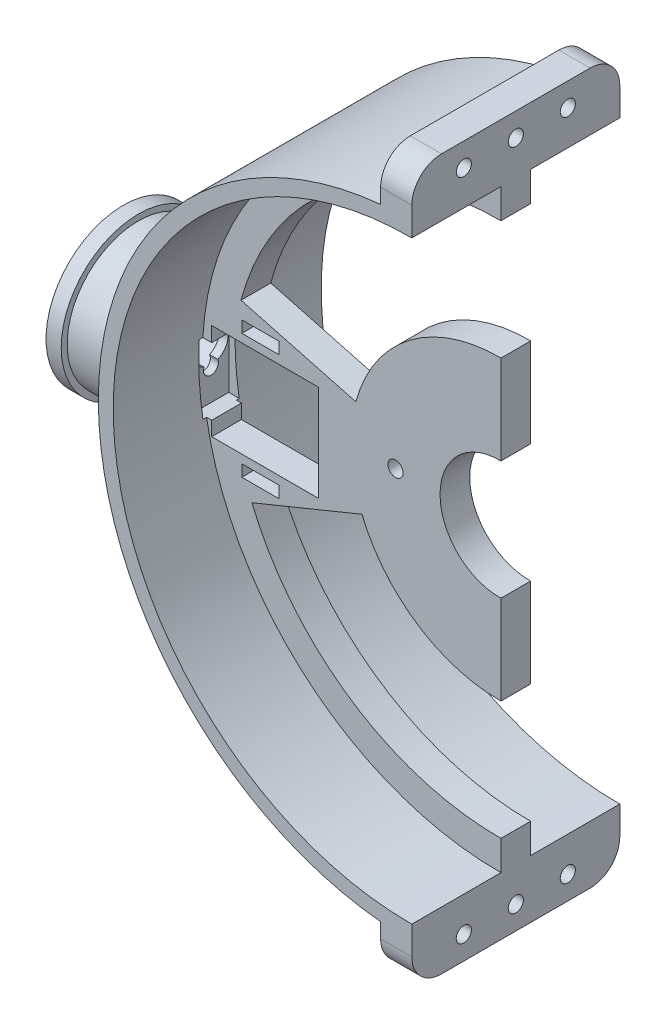
from build123d import *

# Parameters (mm, degrees)
SKETCH_1_W                = 105
SKETCH_1_H                = 10
EXTRUDE_3_DEPTH           = 10
EXTRUDE_3_DEPTH_BACK      = 20
SKETCH_11_R               = 105
SKETCH_11_R_2             = 100
EXTRUDE_START             = 20
SKETCH_12_R               = 105
SKETCH_12_R_2             = 100
EXTRUDE_4_DEPTH           = 20
SKETCH_4_R                = 25.5
SKETCH_4_R_2              = 20.5
EXTRUDE_6_DEPTH           = 20
EXTRUDE_START_2           = -31.598350223
EXTRUDE_7_OUTLINE_R       = 26
EXTRUDE_7_OUTLINE_R_2     = 21
EXTRUDE_7_DEPTH           = 30.598350223
SKETCH_6_R                = 20
CUT_EXTRUDE_1_DEPTH       = 174.040821302
CUT_EXTRUDE_8_DEPTH       = 10
CUT_EXTRUDE_START         = -4.05
SKETCH_17_W               = 12.2
SKETCH_17_H               = 22.6
CUT_EXTRUDE_9_DEPTH       = 6.15
CUT_EXTRUDE_START_2       = -35
CUT_EXTRUDE_10_DEPTH      = 35.9
SKETCH_21_W               = 12.48598734
SKETCH_21_H               = 3.935393954
CUT_EXTRUDE_11_DEPTH      = 174.040821302
SKETCH_23_W               = 21.5
SKETCH_23_H               = 4
MIRROR_START              = -126.5
MIRROR_3_OUTLINE_R        = 26
MIRROR_3_OUTLINE_R_2      = 24
MIRROR_3_DEPTH            = 21.5
SKETCH_24_R               = 20
CUT_EXTRUDE_12_DEPTH      = 174.040821302
SKETCH_25_W               = 5.25
SKETCH_25_H               = 10
CUT_EXTRUDE_13_DEPTH      = 1
EXTRUDE_8_DEPTH           = 35
FILLET_1_R                = 10
FILLET_1_OF_MIRROR_4_R    = 10
M5X0_8_1_D                = 4.2
SKETCH_38_R               = 2.55
CUT_EXTRUDE_17_DEPTH      = 190.567335177
M5X0_8_2_D                = 4.2
CUT_EXTRUDE_18_DEPTH      = 183.219119633
CUT_EXTRUDE_18_DEPTH_BACK = 183.219119633
SKETCH_39_R               = 2.55
CUT_EXTRUDE_14_DEPTH      = 183.219119633
CUT_EXTRUDE_14_DEPTH_BACK = 183.219119633
SKETCH_34_W               = 208.658629851
SKETCH_34_H               = 276.195432186


with BuildPart() as part:
    # 草图1 → 旋转1 (revolve)
    with BuildSketch(Plane(origin=(0, 0, 0), x_dir=(1, 0, 0), z_dir=(0, 1, 0))):
        with Locations((52.5, 5)):
            Rectangle(SKETCH_1_W, SKETCH_1_H)
    revolve(axis=Axis((0, 0, 0), (0, 0, -1)))

    # 草图11 → 凸台-拉伸3 (add, two sides: drawn at the far end of the back side and taken through both)
    with BuildSketch(Plane.XY.offset(-EXTRUDE_3_DEPTH_BACK)):
        Circle(SKETCH_11_R)
        Circle(SKETCH_11_R_2, mode=Mode.SUBTRACT)
    extrude(amount=EXTRUDE_3_DEPTH + EXTRUDE_3_DEPTH_BACK)

    # 草图12 → 凸台-拉伸4 (add)
    with BuildSketch(Plane.XY.offset(10).offset(EXTRUDE_START)):
        Circle(SKETCH_12_R)
        Circle(SKETCH_12_R_2, mode=Mode.SUBTRACT)
    extrude_4 = extrude(amount=-EXTRUDE_4_DEPTH)

    # 镜向1: 凸台-拉伸4 across plane
    add(extrude_4.mirror(Plane.XY.offset(-5)))

    # 草图4 → 凸台-拉伸6 (add)
    with BuildSketch(Plane(origin=(100, 0, 0), x_dir=(0, 0, -1), z_dir=(1, 0, 0))):
        with Locations((5, 0)):
            Circle(SKETCH_4_R)
        with Locations((5, 0)):
            Circle(SKETCH_4_R_2, mode=Mode.SUBTRACT)
    extrude(amount=EXTRUDE_6_DEPTH)

    # 凸台-拉伸7: read off the stored shape, not the designer's step
    # 凸台-拉伸7 outline → 凸台-拉伸7 (add)
    with BuildSketch(Plane(origin=(-100, 0, 0), x_dir=(0, 0, -1), z_dir=(1, 0, 0)).offset(EXTRUDE_START_2)):
        with Locations((5, 0)):
            Circle(EXTRUDE_7_OUTLINE_R)
        with Locations((5, 0)):
            Circle(EXTRUDE_7_OUTLINE_R_2, mode=Mode.SUBTRACT)
    extrude(amount=EXTRUDE_7_DEPTH)

    # 草图6 → 切除-拉伸1 (cut, through all)
    with BuildSketch(Plane.XY):
        with Locations((0, -70)):
            Circle(SKETCH_6_R)
        with Locations(Location((0, 70, 0), (0, 0, 180))):
            Circle(SKETCH_6_R)
    extrude(amount=-CUT_EXTRUDE_1_DEPTH, mode=Mode.SUBTRACT)

    # 草图16 → 切除-拉伸8 (cut)
    with BuildSketch(Plane(origin=(105, 0, 0), x_dir=(0, 0, -1), z_dir=(1, 0, 0))):
        with BuildLine():
            ThreePointArc((7.301532566, -5.323809524), (5, 5.8), (2.698467434, -5.323809524))
            ThreePointArc((2.698467434, -5.323809524), (5, -8.8), (7.301532566, -5.323809524))
        make_face()
    cut_extrude_8 = extrude(amount=-CUT_EXTRUDE_8_DEPTH, mode=Mode.SUBTRACT)

    # 草图17 → 切除-拉伸9 (cut)
    with BuildSketch(Plane(origin=(100, 0, 0), x_dir=(0, 0, -1), z_dir=(1, 0, 0)).offset(CUT_EXTRUDE_START)):
        with Locations((4.890474786, -5.5)):
            Rectangle(SKETCH_17_W, SKETCH_17_H)
    cut_extrude_9 = extrude(amount=CUT_EXTRUDE_9_DEPTH, mode=Mode.SUBTRACT)

    # 草图19 → 切除-拉伸10 (cut)
    with BuildSketch(Plane(origin=(95.95, 0, 0), x_dir=(0, 0, -1), z_dir=(1, 0, 0)).offset(CUT_EXTRUDE_START_2)):
        Polygon((-1.122566441, -16.8), (-1.122566441, 5.8), (-1.122566441, 10.8), (11.077433559, 10.8), (11.077433559, 5.8), (11.077433559, -16.8), (11.077433559, -21.6), (-1.122566441, -21.6), align=None)
    cut_extrude_10 = extrude(amount=CUT_EXTRUDE_10_DEPTH, mode=Mode.SUBTRACT)

    # 镜向2: 切除-拉伸8, 切除-拉伸9, 切除-拉伸10 across plane
    add(cut_extrude_8.mirror(Plane(origin=(0, 0, 0), x_dir=(0, 0, 1), z_dir=(1, 0, 0))), mode=Mode.SUBTRACT)
    add(cut_extrude_9.mirror(Plane(origin=(0, 0, 0), x_dir=(0, 0, 1), z_dir=(1, 0, 0))), mode=Mode.SUBTRACT)
    add(cut_extrude_10.mirror(Plane(origin=(0, 0, 0), x_dir=(0, 0, 1), z_dir=(1, 0, 0))), mode=Mode.SUBTRACT)

    # 草图21 → 切除-拉伸11 (cut, through all)
    with BuildSketch(Plane.XY):
        with Locations((-80.471231892, 15.58208287)):
            Rectangle(SKETCH_21_W, SKETCH_21_H)
        with Locations((-80.471231892, -26.38208287)):
            Rectangle(SKETCH_21_W, SKETCH_21_H)
        with Locations((80.471231892, -26.38208287)):
            Rectangle(SKETCH_21_W, SKETCH_21_H)
        with Locations((80.471231892, 15.58208287)):
            Rectangle(SKETCH_21_W, SKETCH_21_H)
    extrude(amount=-CUT_EXTRUDE_11_DEPTH, mode=Mode.SUBTRACT)

    # 草图23 → 切除-旋转1 (revolve, cut)
    with BuildSketch(Plane.XY.offset(-5), mode=Mode.PRIVATE) as cut_revolve_1_sk:
        with Locations((115.75, 26)):
            Rectangle(SKETCH_23_W, SKETCH_23_H)
    revolve(cut_revolve_1_sk.sketch.rotate(Axis((120, 0, -5), (-1, 0, 0)), 90), axis=Axis((120, 0, -5), (-1, 0, 0)), mode=Mode.SUBTRACT)

    # 镜向3: read off the stored shape, not the designer's step
    # 镜向3 outline → 镜向3 (cut)
    with BuildSketch(Plane.YZ.offset(MIRROR_START)):
        with Locations((0, -5)):
            Circle(MIRROR_3_OUTLINE_R)
        with Locations((0, -5)):
            Circle(MIRROR_3_OUTLINE_R_2, mode=Mode.SUBTRACT)
    extrude(amount=MIRROR_3_DEPTH, mode=Mode.SUBTRACT)

    # 草图24 → 切除-拉伸12 (cut, through all)
    with BuildSketch(Plane.XY):
        Circle(SKETCH_24_R)
        with BuildLine():
            Line((-86.979425588, 23.120975852), (-48.321903105, 12.844986584))
            ThreePointArc((-48.321903105, 12.844986584), (0, 50), (48.321903105, 12.844986584))
            Line((48.321903105, 12.844986584), (86.979425588, 23.120975852))
            ThreePointArc((86.979425588, 23.120975852), (0, 90), (-86.979425588, 23.120975852))
        make_face()
        with BuildLine():
            Line((46.279615655, -18.926097718), (83.303308179, -34.066975893))
            ThreePointArc((83.303308179, -34.066975893), (0, -90), (-83.303308179, -34.066975893))
            Line((-83.303308179, -34.066975893), (-46.279615655, -18.926097718))
            ThreePointArc((-46.279615655, -18.926097718), (0, -50), (46.279615655, -18.926097718))
        make_face()
    extrude(amount=-CUT_EXTRUDE_12_DEPTH, mode=Mode.SUBTRACT)

    # 草图25 → 切除-拉伸13 (cut)
    with BuildSketch(Plane.XZ.offset(-5.8)):
        with Locations((99.475, -5)):
            Rectangle(SKETCH_25_W, SKETCH_25_H)
    extrude(amount=-CUT_EXTRUDE_13_DEPTH, mode=Mode.SUBTRACT)

    # 草图26 → 凸台-拉伸8 (add, symmetric)
    with BuildSketch(Plane.XY.offset(-5)):
        with BuildLine():
            Line((-10, 104.522724802), (-10, 119.522724802))
            Line((-10, 119.522724802), (10, 119.522724802))
            Line((10, 119.522724802), (10, 104.522724802))
            ThreePointArc((10, 104.522724802), (0, 105), (-10, 104.522724802))
        make_face()
    extrude_8 = extrude(amount=EXTRUDE_8_DEPTH, both=True)

    # 圆角1
    fillet_1_edges = [part.edges().sort_by_distance(p)[0] for p in [
        (0, 119.522724802, -40),
        (0, 119.522724802, 30),
    ]]
    fillet(fillet_1_edges, radius=FILLET_1_R)

    # 镜向4: 凸台-拉伸8 across plane
    add(extrude_8.mirror(Plane.ZX))

    # 圆角1 of 镜向4
    fillet_1_of_mirror_4_edges = [part.edges().sort_by_distance(p)[0] for p in [
        (0, -119.522724802, -40),
        (0, -119.522724802, 30),
    ]]
    fillet(fillet_1_of_mirror_4_edges, radius=FILLET_1_OF_MIRROR_4_R)

    # M5x0.8 螺纹孔1 (through all)
    with Locations(Plane(origin=(10, 0, 0), x_dir=(0, 0, -1), z_dir=(1, 0, 0))):
        with Locations((-12.5, 111.675356556), (5, 111.675356556), (22.5, 111.675356556)):
            m5x0_8_1 = Hole(M5X0_8_1_D / 2)

    # 草图38 → 切除-拉伸17 (cut, through all)
    with BuildSketch(Plane(origin=(10, 0, 0), x_dir=(0, 0, -1), z_dir=(1, 0, 0))):
        with Locations((-12.5, 111.675356556)):
            Circle(SKETCH_38_R)
        with Locations((5, 111.675356556)):
            Circle(SKETCH_38_R)
        with Locations((22.5, 111.675356556)):
            Circle(SKETCH_38_R)
    cut_extrude_17 = extrude(amount=-CUT_EXTRUDE_17_DEPTH, mode=Mode.SUBTRACT)

    # 镜向5: M5x0.8 螺纹孔1, 切除-拉伸17 across plane
    add(m5x0_8_1.mirror(Plane.ZX), mode=Mode.SUBTRACT)
    add(cut_extrude_17.mirror(Plane.ZX), mode=Mode.SUBTRACT)

    # M5x0.8 螺纹孔2 (through all)
    with Locations(Plane.XY):
        with Locations((-35, 0), (35, 0)):
            Hole(M5X0_8_2_D / 2)

    # 草图39 → 切除-拉伸18 (cut, two sides: drawn at the far end of the back side and taken through both)
    with BuildSketch(Plane.XY.offset(-CUT_EXTRUDE_18_DEPTH_BACK)):
        with Locations((-35, 0)):
            Circle(SKETCH_39_R)
        with Locations((35, 0)):
            Circle(SKETCH_39_R)
    extrude(amount=CUT_EXTRUDE_18_DEPTH + CUT_EXTRUDE_18_DEPTH_BACK, mode=Mode.SUBTRACT)

    # 草图34 → 切除-拉伸14 (cut, two sides: drawn at the far end of the back side and taken through both)
    with BuildSketch(Plane.XY.offset(-CUT_EXTRUDE_14_DEPTH_BACK)):
        with Locations((104.829314926, -9.366190691)):
            Rectangle(SKETCH_34_W, SKETCH_34_H)
    extrude(amount=CUT_EXTRUDE_14_DEPTH + CUT_EXTRUDE_14_DEPTH_BACK, mode=Mode.SUBTRACT)


solid = part.part
